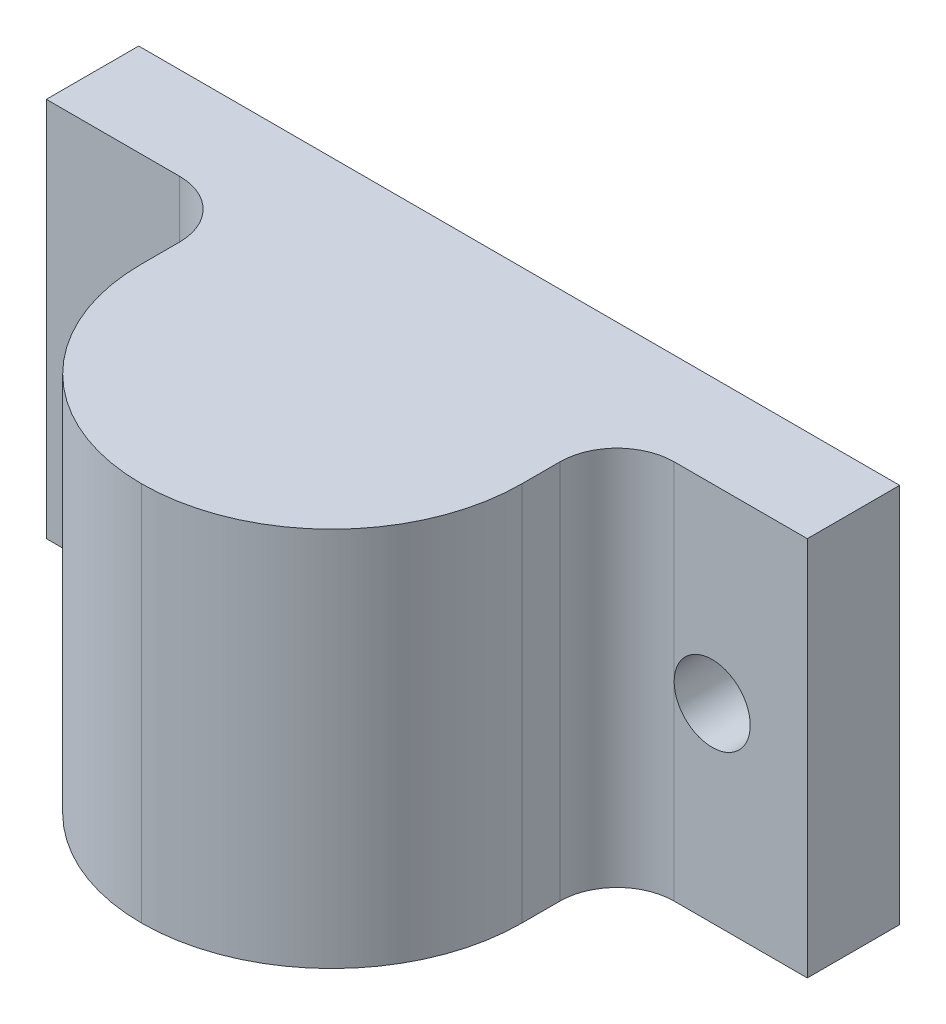
from build123d import *

# Parameters (mm, degrees)
SKETCH6_W           = 40
SKETCH6_H           = 20
BOSS_EXTRUDE3_DEPTH = 19.854784811
SKETCH9_W           = 10
SKETCH9_H           = 20
CUT_EXTRUDE6_DEPTH  = 15
SKETCH10_R          = 4
CUT_EXTRUDE7_DEPTH  = 15
SKETCH11_R          = 2
CUT_EXTRUDE8_DEPTH  = 5
FILLET1_R           = 10
FILLET2_R           = 10
FILLET5_R           = 3


with BuildPart() as part:
    # Sketch6 → Boss-Extrude3 (new body)
    with BuildSketch(Plane.XY):
        Rectangle(SKETCH6_W, SKETCH6_H)
    extrude(amount=BOSS_EXTRUDE3_DEPTH)

    # Sketch9 → Cut-Extrude6 (cut)
    with BuildSketch(Plane.XY.offset(19.854784811)):
        with Locations((-15, 0)):
            Rectangle(SKETCH9_W, SKETCH9_H)
        with Locations((15, 0)):
            Rectangle(SKETCH9_W, SKETCH9_H)
    extrude(amount=-CUT_EXTRUDE6_DEPTH, mode=Mode.SUBTRACT)

    # Sketch10 → Cut-Extrude7 (cut)
    with BuildSketch(Plane.XZ.offset(10)):
        with Locations(Location((0, 12.5, 0), (0, 0, 270))):
            Circle(SKETCH10_R)
    extrude(amount=-CUT_EXTRUDE7_DEPTH, mode=Mode.SUBTRACT)

    # Sketch11 → Cut-Extrude8 (cut)
    with BuildSketch(Plane.XY.offset(4.854784811)):
        with Locations((-15, 0)):
            Circle(SKETCH11_R)
        with Locations((15, 0)):
            Circle(SKETCH11_R)
    extrude(amount=-CUT_EXTRUDE8_DEPTH, mode=Mode.SUBTRACT)

    # Fillet1
    fillet1_edges = [part.edges().sort_by_distance(p)[0] for p in [
        (10, 0, 19.854784811),
    ]]
    fillet(fillet1_edges, radius=FILLET1_R)

    # Fillet2
    fillet2_edges = [part.edges().sort_by_distance(p)[0] for p in [
        (-10, 0, 19.854784811),
    ]]
    fillet(fillet2_edges, radius=FILLET2_R - 0.0001)  # a hair under: the kernel refuses the full size

    # Fillet5
    fillet5_edges = [part.edges().sort_by_distance(p)[0] for p in [
        (-10, 0, 4.854784811),
        (10, 0, 4.854784811),
    ]]
    fillet(fillet5_edges, radius=FILLET5_R - 0.0001)  # a hair under: the kernel refuses the full size


solid = part.part
